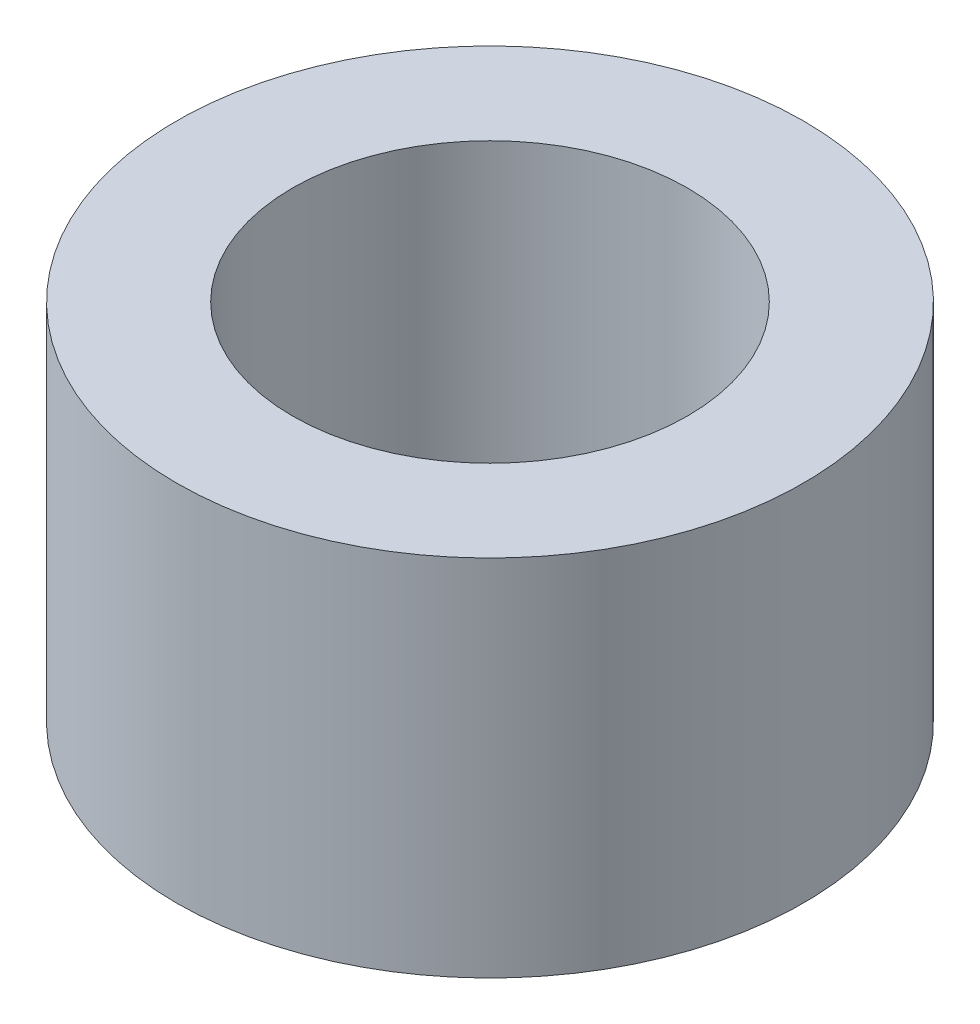
from build123d import *

# Parameters (mm, degrees)
SKETCH1_R           = 6.35
BOSS_EXTRUDE1_DEPTH = 7.366
SKETCH3_R           = 4
CUT_EXTRUDE2_DEPTH  = 12.614773179


with BuildPart() as part:
    # Sketch1 → Boss-Extrude1 (new body)
    with BuildSketch(Plane(origin=(0, 0, 0), x_dir=(1, 0, 0), z_dir=(0, 1, 0))):
        Circle(SKETCH1_R)
    extrude(amount=BOSS_EXTRUDE1_DEPTH)

    # Sketch3 → Cut-Extrude2 (cut, through all)
    with BuildSketch(Plane(origin=(0, 7.366, 0), x_dir=(1, 0, 0), z_dir=(0, 1, 0))):
        Circle(SKETCH3_R)
    extrude(amount=-CUT_EXTRUDE2_DEPTH, mode=Mode.SUBTRACT)


solid = part.part
